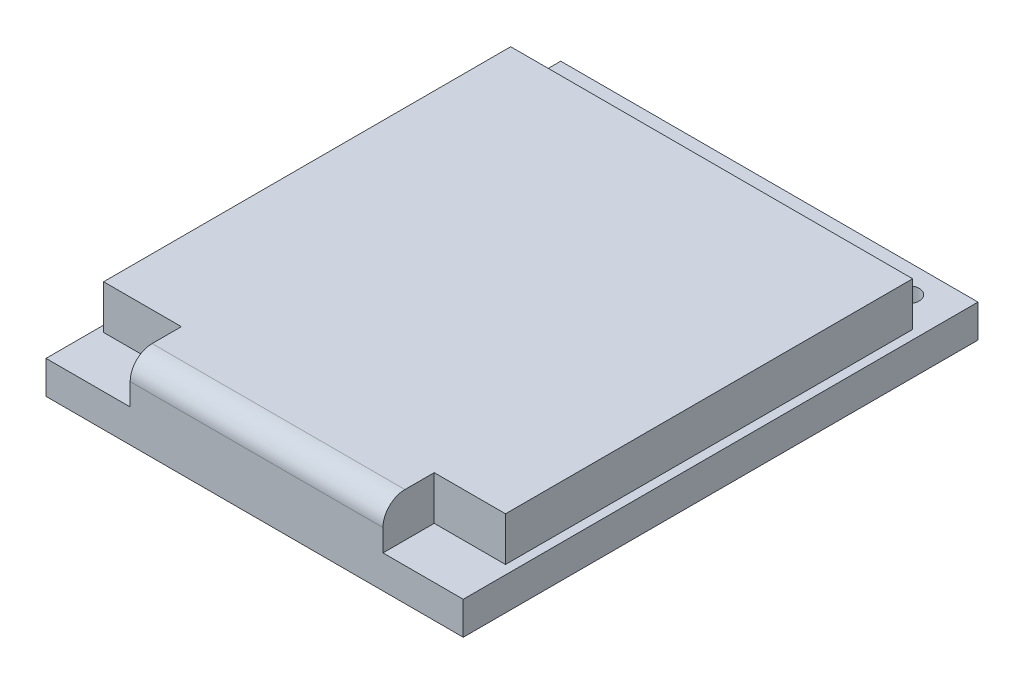
from build123d import *

# Parameters (mm, degrees)
SKETCH1_W           = 19
SKETCH1_H           = 23.44
SKETCH1_R           = 0.5
BOSS_EXTRUDE1_DEPTH = 1.5
BOSS_EXTRUDE2_DEPTH = 2
FILLET1_R           = 1


with BuildPart() as part:
    # Sketch1 → Boss-Extrude1 (new body)
    with BuildSketch(Plane(origin=(0, 0, 0), x_dir=(1, 0, 0), z_dir=(0, 1, 0))):
        with Locations((9.5, -11.72)):
            Rectangle(SKETCH1_W, SKETCH1_H)
        with Locations((1.88, -1.3)):
            Circle(SKETCH1_R, mode=Mode.SUBTRACT)
        with Locations((4.42, -1.3)):
            Circle(SKETCH1_R, mode=Mode.SUBTRACT)
        with Locations((6.96, -1.3)):
            Circle(SKETCH1_R, mode=Mode.SUBTRACT)
        with Locations((9.5, -1.3)):
            Circle(SKETCH1_R, mode=Mode.SUBTRACT)
        with Locations((12.04, -1.3)):
            Circle(SKETCH1_R, mode=Mode.SUBTRACT)
        with Locations((14.58, -1.3)):
            Circle(SKETCH1_R, mode=Mode.SUBTRACT)
        with Locations((17.12, -1.3)):
            Circle(SKETCH1_R, mode=Mode.SUBTRACT)
    extrude(amount=BOSS_EXTRUDE1_DEPTH)

    # Sketch3 → Boss-Extrude2 (add)
    with BuildSketch(Plane(origin=(0, 1.5, 0), x_dir=(1, 0, 0), z_dir=(0, 1, 0))):
        Polygon((3.832385917, -21.106985825), (3.832385917, -23.44), (15.344727023, -23.44), (15.344727023, -21.106985825), (18.591797592, -21.106985825), (18.591797592, -2.569164761), (0.290127115, -2.569164761), (0.290127115, -21.106985825), align=None)
    extrude(amount=BOSS_EXTRUDE2_DEPTH)

    # Fillet1
    fillet1_edges = [part.edges().sort_by_distance(p)[0] for p in [
        (9.58855647, 3.5, 23.44),
    ]]
    fillet(fillet1_edges, radius=FILLET1_R)


solid = part.part
